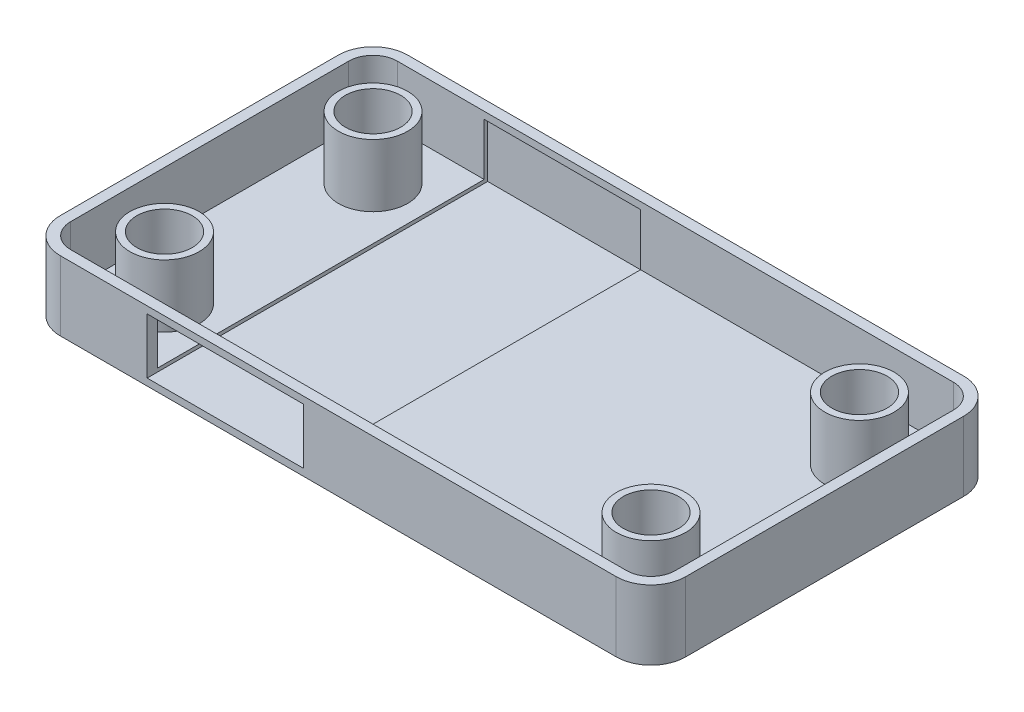
from build123d import *

# Parameters (mm, degrees)
BOSS_EXTRUDE1_DEPTH = 20
SHELL1_T            = -3
SKETCH3_R           = 9.972851257
SKETCH3_R_2         = 7.972851257
BOSS_EXTRUDE2_DEPTH = 18
SKETCH4_W           = 45
SKETCH4_H           = 16
CUT_EXTRUDE2_DEPTH  = 98


with BuildPart() as part:
    # Sketch1 → Boss-Extrude1 (new body)
    with BuildSketch(Plane(origin=(0, 0, 0), x_dir=(1, 0, 0), z_dir=(0, 1, 0))):
        with BuildLine():
            Line((-80, -50), (80, -50))
            ThreePointArc((80, -50), (87.071067812, -47.071067812), (90, -40))
            Line((90, -40), (90, 40))
            ThreePointArc((90, 40), (87.071067812, 47.071067812), (80, 50))
            Line((80, 50), (-80, 50))
            ThreePointArc((-80, 50), (-87.071067812, 47.071067812), (-90, 40))
            Line((-90, 40), (-90, -40))
            ThreePointArc((-90, -40), (-87.071067812, -47.071067812), (-80, -50))
        make_face()
    extrude(amount=BOSS_EXTRUDE1_DEPTH)

    # Shell1
    shell1_openings = [part.faces().sort_by_distance(p)[0] for p in [
        (0, 20, 0),
    ]]
    offset(amount=SHELL1_T, openings=shell1_openings, kind=Kind.INTERSECTION)

    # Sketch3 → Boss-Extrude2 (add)
    # profile 1 of 4: a face of its own
    with BuildSketch(Plane(origin=(0, 3, 0), x_dir=(1, 0, 0), z_dir=(0, 1, 0))):
        with Locations((-70, 30)):
            Circle(SKETCH3_R)
        with Locations((-70, 30)):
            Circle(SKETCH3_R_2, mode=Mode.SUBTRACT)
    # profile 2 of 4: a face of its own
    with BuildSketch(Plane(origin=(0, 3, 0), x_dir=(1, 0, 0), z_dir=(0, 1, 0))):
        with Locations((70, 30)):
            Circle(SKETCH3_R)
        with Locations((70, 30)):
            Circle(SKETCH3_R_2, mode=Mode.SUBTRACT)
    # profile 3 of 4: a face of its own
    with BuildSketch(Plane(origin=(0, 3, 0), x_dir=(1, 0, 0), z_dir=(0, 1, 0))):
        with Locations((70, -30)):
            Circle(SKETCH3_R)
        with Locations((70, -30)):
            Circle(SKETCH3_R_2, mode=Mode.SUBTRACT)
    # profile 4 of 4: a face of its own
    with BuildSketch(Plane(origin=(0, 3, 0), x_dir=(1, 0, 0), z_dir=(0, 1, 0))):
        with Locations((-70, -30)):
            Circle(SKETCH3_R)
        with Locations((-70, -30)):
            Circle(SKETCH3_R_2, mode=Mode.SUBTRACT)
    extrude(amount=BOSS_EXTRUDE2_DEPTH)

    # Sketch4 → Cut-Extrude2 (cut)
    with BuildSketch(Plane.XY.offset(50)):
        with Locations((-32.5, 10)):
            Rectangle(SKETCH4_W, SKETCH4_H)
    extrude(amount=-CUT_EXTRUDE2_DEPTH, mode=Mode.SUBTRACT)


solid = part.part
